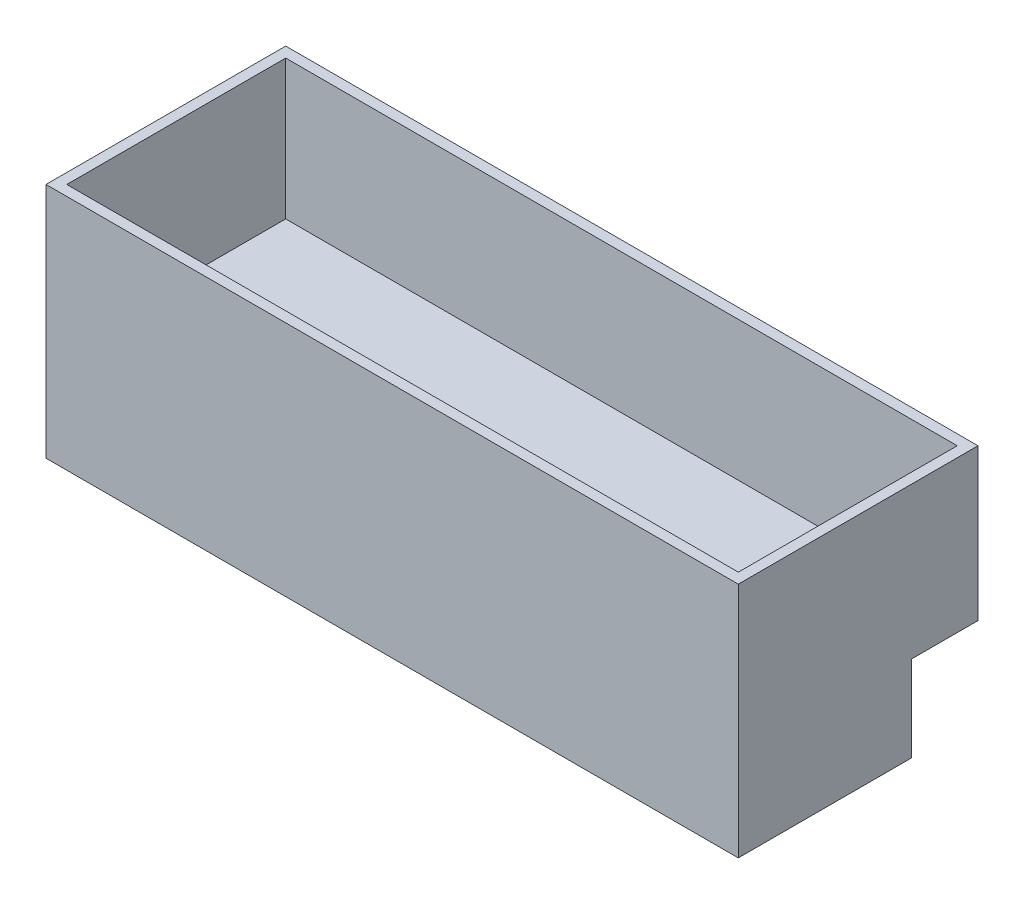
from build123d import *

# Parameters (mm, degrees)
SKIZZE1_W                       = 800
SKIZZE1_H                       = 200
AUFSATZ_LINEAR_AUSTRAGEN1_DEPTH = 274
SKIZZE2_W                       = 15
SKIZZE2_H                       = 170
AUFSATZ_LINEAR_AUSTRAGEN2_DEPTH = 6
SKIZZE4_W                       = 800
SKIZZE4_H                       = 175
AUFSATZ_LINEAR_AUSTRAGEN3_DEPTH = 77
SKIZZE5_W                       = 776
SKIZZE5_H                       = 253
SCHNITT_LINEAR_AUSTRAGEN2_DEPTH = 161


with BuildPart() as part:
    # Skizze1 → Aufsatz-Linear austragen1 (new body)
    with BuildSketch(Plane(origin=(0, 0, 0), x_dir=(1, 0, 0), z_dir=(0, 1, 0))):
        with Locations((17.371106882, 37.147335423)):
            Rectangle(SKIZZE1_W, SKIZZE1_H)
    extrude(amount=AUFSATZ_LINEAR_AUSTRAGEN1_DEPTH)

    # Skizze2 → Aufsatz-Linear austragen2 (add)
    with BuildSketch(Plane(origin=(0, 0, 0), x_dir=(-1, 0, 0), z_dir=(0, -1, 0))):
        with Locations((340.128893118, 37.147335423)):
            Rectangle(SKIZZE2_W, SKIZZE2_H)
        with Locations((-344.871106882, 37.147335423)):
            Rectangle(SKIZZE2_W, SKIZZE2_H)
    extrude(amount=AUFSATZ_LINEAR_AUSTRAGEN2_DEPTH)

    # Skizze4 → Aufsatz-Linear austragen3 (add)
    with BuildSketch(Plane(origin=(0, 0, -137.147335423), x_dir=(-1, 0, 0), z_dir=(0, 0, -1))):
        with Locations((-17.371106882, 186.5)):
            Rectangle(SKIZZE4_W, SKIZZE4_H)
    extrude(amount=AUFSATZ_LINEAR_AUSTRAGEN3_DEPTH)

    # Skizze5 → Schnitt-Linear austragen2 (cut)
    with BuildSketch(Plane(origin=(0, 274, 0), x_dir=(1, 0, 0), z_dir=(0, 1, 0))):
        with Locations((17.371106882, 75.647335423)):
            Rectangle(SKIZZE5_W, SKIZZE5_H)
    extrude(amount=-SCHNITT_LINEAR_AUSTRAGEN2_DEPTH, mode=Mode.SUBTRACT)


solid = part.part
